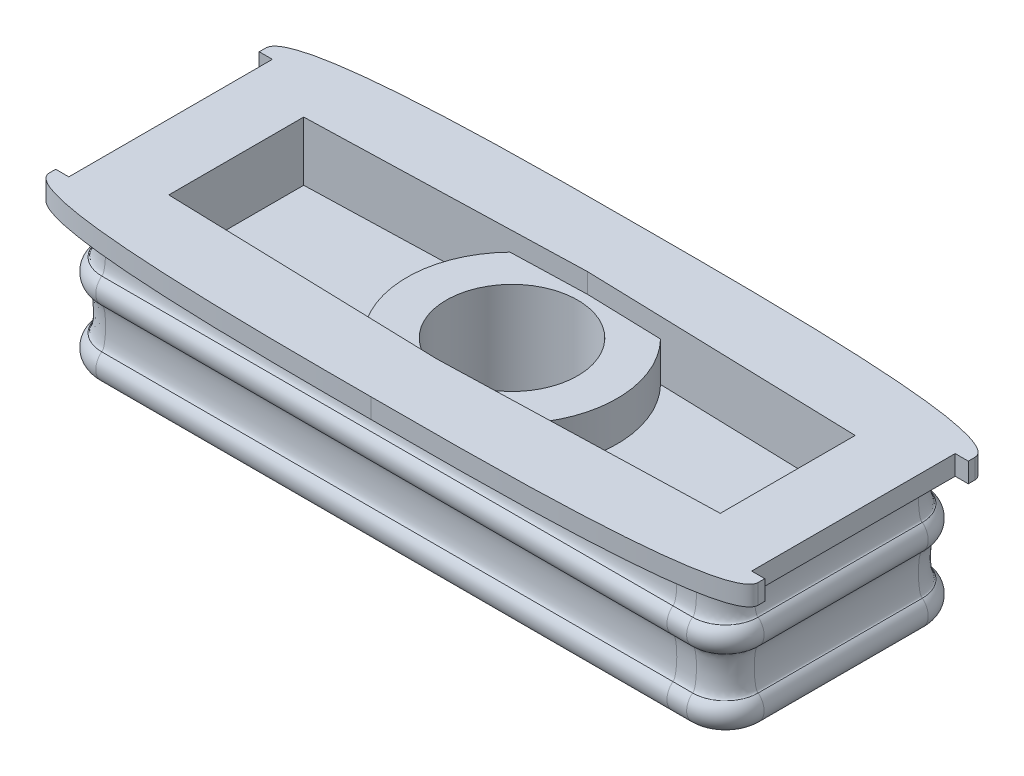
from build123d import *

# Parameters (mm, degrees)
SKETCH1_W           = 12.7
SKETCH1_H           = 4.445
BOSS_EXTRUDE1_DEPTH = 2.54
BOSS_EXTRUDE2_DEPTH = 0.381
SKETCH3_R           = 1.27
CUT_EXTRUDE1_DEPTH  = 15.405430308
CUT_EXTRUDE2_DEPTH  = 1.143
BOSS_EXTRUDE3_START = 0.762
SKETCH5_R           = 2.032
SKETCH5_R_2         = 1.27
BOSS_EXTRUDE3_DEPTH = 0.762
FILLET1_R           = 0.635
SKETCH9_R           = 0.3175
FILLET2_R           = 0.635


with BuildPart() as part:
    # Sketch1 → Boss-Extrude1 (new body)
    with BuildSketch(Plane(origin=(0, 0, 0), x_dir=(1, 0, 0), z_dir=(0, 1, 0))):
        with Locations((6.35, 2.2225)):
            Rectangle(SKETCH1_W, SKETCH1_H)
    extrude(amount=BOSS_EXTRUDE1_DEPTH)

    # Sketch2 → Boss-Extrude2 (add)
    with BuildSketch(Plane(origin=(0, 2.54, 0), x_dir=(1, 0, 0), z_dir=(0, 1, 0))):
        with BuildLine():
            Line((-0.254, 4.191), (-0.254, 0.254))
            Line((-0.254, 0.254), (-0.508, 0.254))
            Line((-0.508, 0.254), (-0.508, 0.127))
            add(Edge.make_bspline(
                [(-0.508, 0.127), (-0.508, -0.528510718), (4.272610044, -0.508), (6.35, -0.508)],
                knots=[0, 0, 0, 0, 1, 1, 1, 1], degree=3))
            add(Edge.make_bspline(
                [(13.208, 0.127), (13.208, -0.528510718), (8.427389956, -0.508), (6.35, -0.508)],
                knots=[0, 0, 0, 0, 1, 1, 1, 1], degree=3))
            Line((13.208, 0.127), (13.208, 0.254))
            Line((13.208, 0.254), (12.954, 0.254))
            Line((12.954, 0.254), (12.954, 4.191))
            Line((12.954, 4.191), (13.208, 4.191))
            Line((13.208, 4.191), (13.208, 4.318))
            add(Edge.make_bspline(
                [(13.208, 4.318), (13.208, 4.973510718), (8.427389956, 4.953), (6.35, 4.953)],
                knots=[0, 0, 0, 0, 1, 1, 1, 1], degree=3))
            add(Edge.make_bspline(
                [(-0.508, 4.318), (-0.508, 4.973510718), (4.272610044, 4.953), (6.35, 4.953)],
                knots=[0, 0, 0, 0, 1, 1, 1, 1], degree=3))
            Line((-0.508, 4.318), (-0.508, 4.191))
            Line((-0.508, 4.191), (-0.254, 4.191))
        make_face()
    extrude(amount=BOSS_EXTRUDE2_DEPTH)

    # Sketch3 → Cut-Extrude1 (cut, through all)
    with BuildSketch(Plane(origin=(0, 2.921, 0), x_dir=(1, 0, 0), z_dir=(0, 1, 0))):
        with Locations(Location((6.35, 2.2225, 0), (0, 0, 270))):
            Circle(SKETCH3_R)
    extrude(amount=-CUT_EXTRUDE1_DEPTH, mode=Mode.SUBTRACT)

    # Sketch4 → Cut-Extrude2 (cut)
    with BuildSketch(Plane(origin=(0, 2.921, 0), x_dir=(1, 0, 0), z_dir=(0, 1, 0))):
        Polygon((11.684, 3.527120203), (11.684, 0.917879797), (6.35, 0.762), (1.016, 0.917879797), (1.016, 3.527120203), (6.35, 3.683), align=None)
    extrude(amount=-CUT_EXTRUDE2_DEPTH, mode=Mode.SUBTRACT)

    # Sketch5 → Boss-Extrude3 (add)
    with BuildSketch(Plane(origin=(0, 1.778, 0), x_dir=(1, 0, 0), z_dir=(0, 1, 0)).offset(BOSS_EXTRUDE3_START)):
        with Locations((6.35, 2.2225)):
            Circle(SKETCH5_R)
        with Locations(Location((6.35, 2.2225, 0), (0, 0, 270))):
            Circle(SKETCH5_R_2, mode=Mode.SUBTRACT)
    extrude(amount=-BOSS_EXTRUDE3_DEPTH)

    # Fillet1
    fillet1_edges = [part.edges().sort_by_distance(p)[0] for p in [
        (0, 1.27, -4.445),
        (12.7, 1.27, -4.445),
        (12.7, 1.27, 0),
        (0, 1.27, 0),
    ]]
    fillet(fillet1_edges, radius=FILLET1_R)

    # Sweep13: sweep along a path in Sketch8
    with BuildLine(Plane(origin=(0, 0, 0), x_dir=(-1, 0, 0), z_dir=(0, -1, 0))) as sweep13_path:
        Line((-0.635, 4.445), (-12.065, 4.445))
        ThreePointArc((-12.065, 4.445), (-12.514012806, 4.259012806), (-12.7, 3.81))
        Line((-12.7, 3.81), (-12.7, 0.635))
        ThreePointArc((-12.7, 0.635), (-12.514012806, 0.185987194), (-12.065, 0))
        Line((-12.065, 0), (-0.635, 0))
        ThreePointArc((-0.635, 0), (-0.185987194, 0.185987194), (0, 0.635))
        Line((0, 0.635), (0, 3.81))
        ThreePointArc((0, 3.81), (-0.185987194, 4.259012806), (-0.635, 4.445))
    # Sketch9 → Sweep13 (sweep)
    with BuildSketch(Plane.ZY.offset(-11.684)):
        with Locations((-0.2032, 0.3175)):
            Circle(SKETCH9_R)
        with Locations((-0.2032, 1.5875)):
            Circle(SKETCH9_R)
    sweep(path=sweep13_path.line)

    # Cut-Sweep9: sweep along a path in Sketch11
    with BuildLine(Plane.XZ) as cut_sweep9_path:
        Line((0, -3.81), (0, -0.635))
        ThreePointArc((0, -0.635), (0.185987194, -0.185987194), (0.635, 0))
        Line((0.635, 0), (12.065, 0))
        ThreePointArc((12.065, 0), (12.514012806, -0.185987194), (12.7, -0.635))
        Line((12.7, -0.635), (12.7, -3.81))
        ThreePointArc((12.7, -3.81), (12.514012806, -4.259012806), (12.065, -4.445))
        Line((12.065, -4.445), (0.635, -4.445))
        ThreePointArc((0.635, -4.445), (0.185987194, -4.259012806), (0, -3.81))
    # Sketch10 → Cut-Sweep9 (sweep, cut)
    with BuildSketch(Plane.ZY.offset(-11.684)):
        with BuildLine():
            Line((0, 1.831459033), (0, 2.54))
            add(Edge.make_bspline(
                [(0, 2.54), (-0.0762, 2.54), (-0.0762, 2.185729517), (-0.0762, 1.831459033), (0, 1.831459033)],
                knots=[0, 0, 0, 1.570796327, 1.570796327, 3.141592654, 3.141592654, 3.141592654], degree=2, weights=[1, 0.707106781, 1, 0.707106781, 1]))
        make_face()
        with BuildLine():
            Line((0, 0.561459033), (0, 1.343540967))
            add(Edge.make_bspline(
                [(0, 1.343540967), (-0.0762, 1.343540967), (-0.0762, 0.9525), (-0.0762, 0.561459033), (0, 0.561459033)],
                knots=[0, 0, 0, 1.570796327, 1.570796327, 3.141592654, 3.141592654, 3.141592654], degree=2, weights=[1, 0.707106781, 1, 0.707106781, 1]))
        make_face()
    sweep(path=cut_sweep9_path.line, mode=Mode.SUBTRACT)

    # Fillet2
    # the kernel refuses this fillet: 0.635 mm, written as the material it takes off along each edge
    with BuildSketch(Plane(origin=(12.065, 0, -0.635), x_dir=(1, 0, 0), z_dir=(0, 0, -1))) as fillet2_piece_1:
        with BuildLine():
            CenterArc((0.338371017, -0.635), FILLET2_R, 62.151694413, 27.848305587)
            Line((0.635, -0.073540967), (0.635, 0))
            Line((0.635, 0), (0.338371017, 0))
        make_face()
    revolve(axis=Axis((12.065, 0, -0.635), (0, -1, 0)), revolution_arc=90, mode=Mode.SUBTRACT)
    with BuildSketch(Plane(origin=(0.635, 0, 0), x_dir=(0, 0, -1), z_dir=(1, 0, 0)), Plane(origin=(12.065, 0, -4.445), x_dir=(0, 0, 1), z_dir=(-1, 0, 0))) as fillet2_piece_2:
        with BuildLine():
            CenterArc((0.296628983, 0.635), FILLET2_R, 242.151694413, 27.848305587)
            Line((0, 0.073540967), (0, 0))
            Line((0, 0), (0.296628983, 0))
        make_face()
    extrude(amount=11.43, mode=Mode.SUBTRACT)
    with BuildSketch(Plane(origin=(0.635, 0, -0.635), x_dir=(-1, 0, 0), z_dir=(0, 0, -1))) as fillet2_piece_3:
        with BuildLine():
            CenterArc((0.338371017, 0.635), FILLET2_R, 270, 27.848305587)
            Line((0.635, 0.073540967), (0.635, 0))
            Line((0.635, 0), (0.338371017, 0))
        make_face()
    revolve(axis=Axis((0.635, 0, -0.635), (0, 1, 0)), revolution_arc=90, mode=Mode.SUBTRACT)
    with BuildSketch(Plane(origin=(0, 0, -3.81), x_dir=(1, 0, 0), z_dir=(0, 0, 1)), Plane(origin=(12.7, 0, -0.635), x_dir=(-1, 0, 0), z_dir=(0, 0, -1))) as fillet2_piece_4:
        with BuildLine():
            CenterArc((0.296628983, 0.635), FILLET2_R, 242.151694413, 27.848305587)
            Line((0, 0.073540967), (0, 0))
            Line((0, 0), (0.296628983, 0))
        make_face()
    extrude(amount=3.175, mode=Mode.SUBTRACT)
    with BuildSketch(Plane(origin=(0.635, 0, -3.81), x_dir=(0, 0, -1), z_dir=(1, 0, 0))) as fillet2_piece_5:
        with BuildLine():
            CenterArc((0.338371017, 0.635), FILLET2_R, 270, 27.848305587)
            Line((0.635, 0.073540967), (0.635, 0))
            Line((0.635, 0), (0.338371017, 0))
        make_face()
    revolve(axis=Axis((0.635, 0, -3.81), (0, 1, 0)), revolution_arc=90, mode=Mode.SUBTRACT)
    with BuildSketch(Plane(origin=(12.065, 0, -3.81), x_dir=(0, 0, -1), z_dir=(-1, 0, 0))) as fillet2_piece_6:
        with BuildLine():
            CenterArc((0.338371017, -0.635), FILLET2_R, 62.151694413, 27.848305587)
            Line((0.635, -0.073540967), (0.635, 0))
            Line((0.635, 0), (0.338371017, 0))
        make_face()
    revolve(axis=Axis((12.065, 0, -3.81), (0, -1, 0)), revolution_arc=90, mode=Mode.SUBTRACT)


solid = part.part
